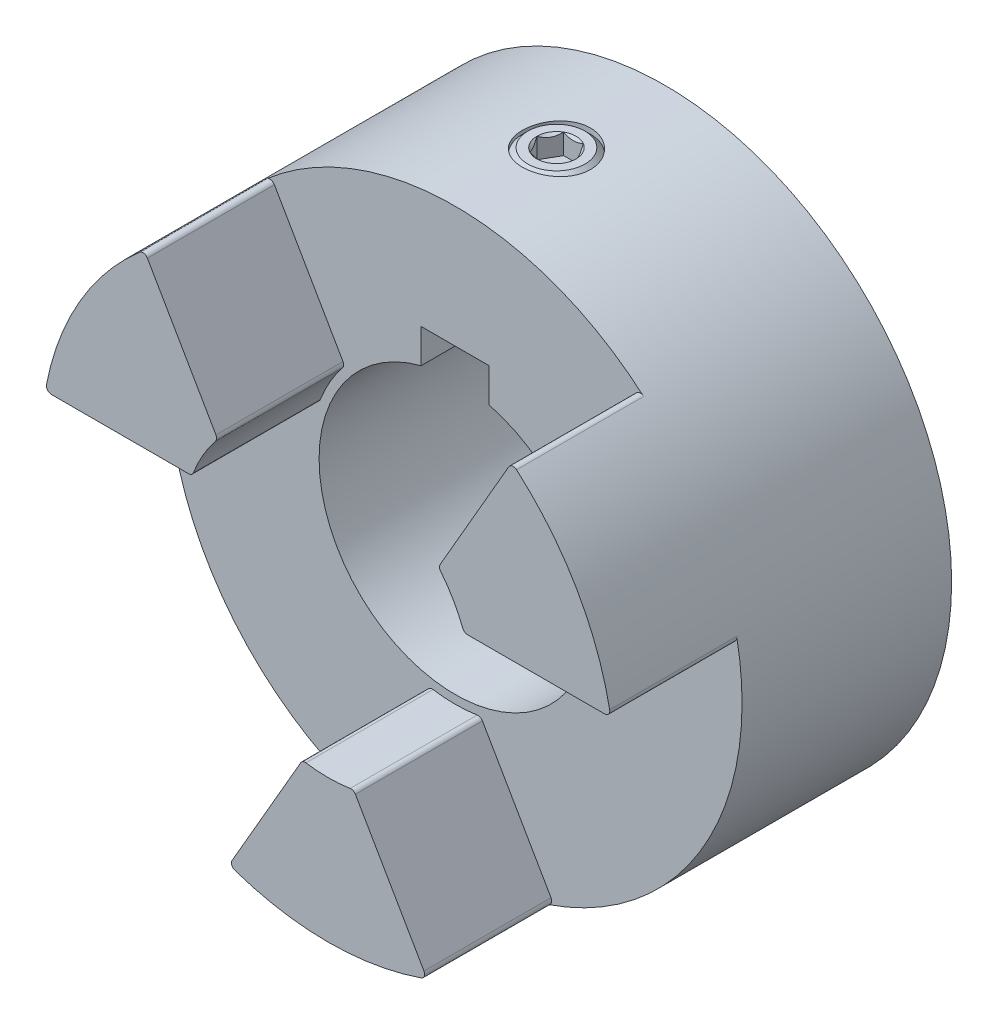
from build123d import *
from OCP.BRepFilletAPI import BRepFilletAPI_MakeChamfer

# Parameters (mm, degrees)
BOSS_EXTRUDE1_START      = -6.746875
SKETCH1_R                = 26.7890625
BOSS_EXTRUDE1_DEPTH      = 20.6375
BOSS_EXTRUDE2_DEPTH      = 11.8618
FILLET1_R                = 0.476990821
CIRPATTERN1_COUNT        = 3
FILLET1_OF_CIRPATTERN1_R = 0.476990821
CUT_EXTRUDE5_DEPTH       = 47.746248335
CUT_EXTRUDE5_DEPTH_BACK  = 47.746248335
SKETCH15_R               = 12.7
CHAMFER1_SIZE            = 1.0715625
CHAMFER1_SIZE2           = 1.588656738
CUT_EXTRUDE1_DEPTH       = 47.746248335
CUT_EXTRUDE1_DEPTH_BACK  = 47.746248335
SKETCH5_R                = 3.175
CUT_EXTRUDE2_DEPTH       = 47.746248335
SKETCH6_R                = 3.175
BOSS_EXTRUDE3_DEPTH      = 7.9375
CUT_EXTRUDE3_DEPTH       = 1.905
CHAMFER3_SIZE            = 0.508
CHAMFER4_SIZE            = 1.0795


with BuildPart() as part:
    # Sketch1 → Boss-Extrude1 (new body)
    with BuildSketch(Plane.XY.offset(BOSS_EXTRUDE1_START)):
        Circle(SKETCH1_R)
    extrude(amount=-BOSS_EXTRUDE1_DEPTH)

    # Sketch2 → Boss-Extrude2 (add)
    with BuildSketch(Plane.XY.offset(-6.746875)):
        with BuildLine():
            Line((-9.238549561, -25.145637229), (-2.384954104, -13.274861682))
            ThreePointArc((-2.384954104, -13.274861682), (0, -13.4874), (2.384954104, -13.274861682))
            Line((2.384954104, -13.274861682), (9.238549561, -25.145637229))
            ThreePointArc((9.238549561, -25.145637229), (0, -26.7890625), (-9.238549561, -25.145637229))
        make_face()
    boss_extrude2 = extrude(amount=BOSS_EXTRUDE2_DEPTH)

    # Fillet1
    # the kernel refuses this fillet: 0.476990821 mm, written as the material it takes off along each edge
    with BuildSketch(Plane(origin=(-9.238549561, -25.145637229, -6.746875), x_dir=(0.9423194959651416, -0.33471475546202245, 0), z_dir=(0, 0, 1))) as fillet1_piece_1:
        with BuildLine():
            CenterArc((0.572952448, 0.476963054), FILLET1_R, 169.55519331, 101.063030663)
            Line((0.103865366, 0.563435893), (0, 0))
            ThreePointArc((0, 0), (0.28904955, -0.001559444), (0.5780991, 0))
        make_face()
    extrude(amount=13.307047751, mode=Mode.SUBTRACT)
    with BuildSketch(Plane(origin=(9.238549561, -25.145637229, -6.746875), x_dir=(-0.9423194959651411, -0.3347147554620237, 0), z_dir=(0, 0, 1))) as fillet1_piece_2:
        with BuildLine():
            CenterArc((0.572952448, -0.476963054), FILLET1_R, 89.381776027, 101.063030663)
            Line((0.103865366, -0.563435893), (0, 0))
            ThreePointArc((0, 0), (0.28904955, 0.001559444), (0.5780991, 0))
        make_face()
    extrude(amount=13.307047751, mode=Mode.SUBTRACT)
    with BuildSketch(Plane(origin=(2.384954104, -13.274861682, -6.746875), x_dir=(0.49999999999999706, -0.8660254037844404, 0), z_dir=(0, 0, 1))) as fillet1_piece_3:
        with BuildLine():
            CenterArc((0.330829178, -0.476990821), FILLET1_R, 90, 68.803855098)
            ThreePointArc((-0.113892323, -0.304529143), (-0.056028498, -0.152607773), (0, 0))
            Line((0, 0), (0.330829178, 0))
        make_face()
    extrude(amount=12.688872944, mode=Mode.SUBTRACT)
    with BuildSketch(Plane(origin=(-2.384954104, -13.274861682, -6.746875), x_dir=(0.9863015455813384, -0.16495229972286882, 0), z_dir=(0, 0, 1))) as fillet1_piece_4:
        with BuildLine():
            CenterArc((0.330879129, -0.476956172), FILLET1_R, 90.690608377, 68.803855098)
            Line((-0.115888763, -0.309867293), (0, 0))
            ThreePointArc((0, 0), (0.162564956, -0.000979741), (0.325129912, 0))
        make_face()
    extrude(amount=12.688872944, mode=Mode.SUBTRACT)

    # CirPattern1: Boss-Extrude2 ×3 about axis
    cirpattern1_axis = Axis((0, 0, 0), (0, 0, 1))
    for i in range(1, CIRPATTERN1_COUNT):
        add(boss_extrude2.rotate(cirpattern1_axis, i * 360 / CIRPATTERN1_COUNT))

    # Fillet1 of CirPattern1
    # the kernel refuses this fillet: 0.476990821 mm, written as the material it takes off along each edge
    with BuildSketch(Plane(origin=(26.396035415, 4.572, -6.746875), x_dir=(-0.18128826673094764, 0.9834299997181745, 0), z_dir=(0, 0, 1)), Plane(origin=(-17.157485854, 20.573637229, -6.746875), x_dir=(-0.761031229234182, -0.6487152442561451, 0), z_dir=(0, 0, 1))) as fillet1_of_cirpattern1_piece_1:
        with BuildLine():
            CenterArc((0.572952448, 0.476963054), FILLET1_OF_CIRPATTERN1_R, 169.55519331, 101.063030663)
            Line((0.103865366, 0.563435893), (0, 0))
            ThreePointArc((0, 0), (0.28904955, -0.001559444), (0.5780991, 0))
        make_face()
    extrude(amount=13.307047751, mode=Mode.SUBTRACT)
    with BuildSketch(Plane(origin=(17.157485854, 20.573637229, -6.746875), x_dir=(0.7610312292341833, -0.6487152442561435, 0), z_dir=(0, 0, 1)), Plane(origin=(-26.396035415, 4.572, -6.746875), x_dir=(0.181288266730962, 0.9834299997181718, 0), z_dir=(0, 0, 1))) as fillet1_of_cirpattern1_piece_2:
        with BuildLine():
            CenterArc((0.572952448, -0.476963054), FILLET1_OF_CIRPATTERN1_R, 89.381776027, 101.063030663)
            Line((0.103865366, -0.563435893), (0, 0))
            ThreePointArc((0, 0), (0.28904955, 0.001559444), (0.5780991, 0))
        make_face()
    extrude(amount=13.307047751, mode=Mode.SUBTRACT)
    with BuildSketch(Plane(origin=(10.303890396, 8.702861682, -6.746875), x_dir=(0.5000000000000006, 0.8660254037844383, 0), z_dir=(0, 0, 1)), Plane(origin=(-12.688844501, 4.572, -6.746875), x_dir=(-1, 0, 0), z_dir=(0, 0, 1))) as fillet1_of_cirpattern1_piece_3:
        with BuildLine():
            CenterArc((0.330829178, -0.476990821), FILLET1_OF_CIRPATTERN1_R, 90, 68.803855098)
            ThreePointArc((-0.113892323, -0.304529143), (-0.056028498, -0.152607773), (0, 0))
            Line((0, 0), (0.330829178, 0))
        make_face()
    extrude(amount=12.688872944, mode=Mode.SUBTRACT)
    with BuildSketch(Plane(origin=(12.688844501, 4.572, -6.746875), x_dir=(-0.3502978908180006, 0.9366383441267288, 0), z_dir=(0, 0, 1)), Plane(origin=(-10.303890396, 8.702861682, -6.746875), x_dir=(-0.6360036547633316, -0.7716860444038657, 0), z_dir=(0, 0, 1))) as fillet1_of_cirpattern1_piece_4:
        with BuildLine():
            CenterArc((0.330879129, -0.476956172), FILLET1_OF_CIRPATTERN1_R, 90.690608377, 68.803855098)
            Line((-0.115888763, -0.309867293), (0, 0))
            ThreePointArc((0, 0), (0.162564956, -0.000979741), (0.325129912, 0))
        make_face()
    extrude(amount=12.688872944, mode=Mode.SUBTRACT)

    # Sketch15 → Cut-Extrude5 (cut, two sides: drawn at the far end of the back side and taken through both)
    with BuildSketch(Plane.XY.offset(-CUT_EXTRUDE5_DEPTH_BACK)):
        Circle(SKETCH15_R)
    extrude(amount=CUT_EXTRUDE5_DEPTH + CUT_EXTRUDE5_DEPTH_BACK, mode=Mode.SUBTRACT)

    # Chamfer1: one chamfer whose edges measure the first distance from different faces: ONE call of the kernel's chamfer builder (chamfer() names one face for all edges)
    chamfer1_edges_1 = [part.edges().sort_by_distance(p)[0] for p in [
        (-26.7890625, 0, -27.384375),
    ]]
    chamfer1_side_1 = [part.faces().sort_by_distance(p)[0] for p in [
        (-26.7890625, 0, -17.065625),
    ]]
    chamfer1_edges_2 = [part.edges().sort_by_distance(p)[0] for p in [
        (-12.7, 0, -27.384375),
    ]]
    chamfer1_side_2 = [part.faces().sort_by_distance(p)[0] for p in [
        (-12.7, 0, -17.065625),
    ]]
    chamfer1 = BRepFilletAPI_MakeChamfer(part.part.solid().wrapped)
    for e in chamfer1_edges_1:
        chamfer1.Add(CHAMFER1_SIZE, CHAMFER1_SIZE2, e.wrapped, chamfer1_side_1[0].wrapped)  # the first distance lies on this face
    for e in chamfer1_edges_2:
        chamfer1.Add(CHAMFER1_SIZE, CHAMFER1_SIZE2, e.wrapped, chamfer1_side_2[0].wrapped)  # the first distance lies on this face
    add(Compound.cast(chamfer1.Shape()), mode=Mode.REPLACE)

    # Sketch4 → Cut-Extrude1 (cut, two sides: drawn at the far end of the back side and taken through both)
    with BuildSketch(Plane.XY.offset(-CUT_EXTRUDE1_DEPTH_BACK)):
        with BuildLine():
            Line((-3.175, 15.471722124), (3.175, 15.471722124))
            Line((3.175, 15.471722124), (3.175, 12.296722124))
            ThreePointArc((3.175, 12.296722124), (0, 12.7), (-3.175, 12.296722124))
            Line((-3.175, 12.296722124), (-3.175, 15.471722124))
        make_face()
    extrude(amount=CUT_EXTRUDE1_DEPTH + CUT_EXTRUDE1_DEPTH_BACK, mode=Mode.SUBTRACT)

    # Sketch5 → Cut-Extrude2 (cut, through all)
    with BuildSketch(Plane(origin=(0, 0, 0), x_dir=(1, 0, 0), z_dir=(0, 1, 0))):
        with Locations(Location((0, 16.208375, 0), (0, 0, 90))):
            Circle(SKETCH5_R)
    extrude(amount=CUT_EXTRUDE2_DEPTH, mode=Mode.SUBTRACT)


with BuildPart() as body_2:
    # Sketch6 → Boss-Extrude3 (new body)
    with BuildSketch(Plane(origin=(0, 26.7890625, 0), x_dir=(-1, 0, 0), z_dir=(0, 1, 0))):
        with Locations(Location((0, -16.208375, 0), (0, 0, 90))):
            Circle(SKETCH6_R)
    extrude(amount=-BOSS_EXTRUDE3_DEPTH)

    # Sketch8 → Cut-Extrude3 (cut)
    with BuildSketch(Plane(origin=(0, 26.7890625, 0), x_dir=(1, 0, 0), z_dir=(0, 1, 0))):
        Polygon((0.916543552, 14.620875), (1.833087105, 16.208375), (0.916543552, 17.795875), (-0.916543552, 17.795875), (-1.833087105, 16.208375), (-0.916543552, 14.620875), align=None)
    extrude(amount=-CUT_EXTRUDE3_DEPTH, mode=Mode.SUBTRACT)

    # Cut-Extrude4 cone 1 section (through the dimple's axis) → Cut-Extrude4 (revolve, cut)
    with BuildSketch(Plane(origin=(0, 26.7890625, -16.208375), x_dir=(0, 0, 1), z_dir=(1, 0, 0))):
        Polygon((0, 0), (1.833087105, 0), (0, 1.833087105), align=None)
    revolve(axis=Axis((0, 26.7890625, -16.208375), (0, -1, 0)), mode=Mode.SUBTRACT)

    # Chamfer3
    chamfer3_edges = [body_2.edges().sort_by_distance(p)[0] for p in [
        (0, 26.7890625, -19.383375),
    ]]
    chamfer(chamfer3_edges, length=CHAMFER3_SIZE)

    # Chamfer4
    chamfer4_edges = [body_2.edges().sort_by_distance(p)[0] for p in [
        (0, 18.8515625, -19.383375),
    ]]
    chamfer(chamfer4_edges, length=CHAMFER4_SIZE)


solid = Compound([part.part, body_2.part])
